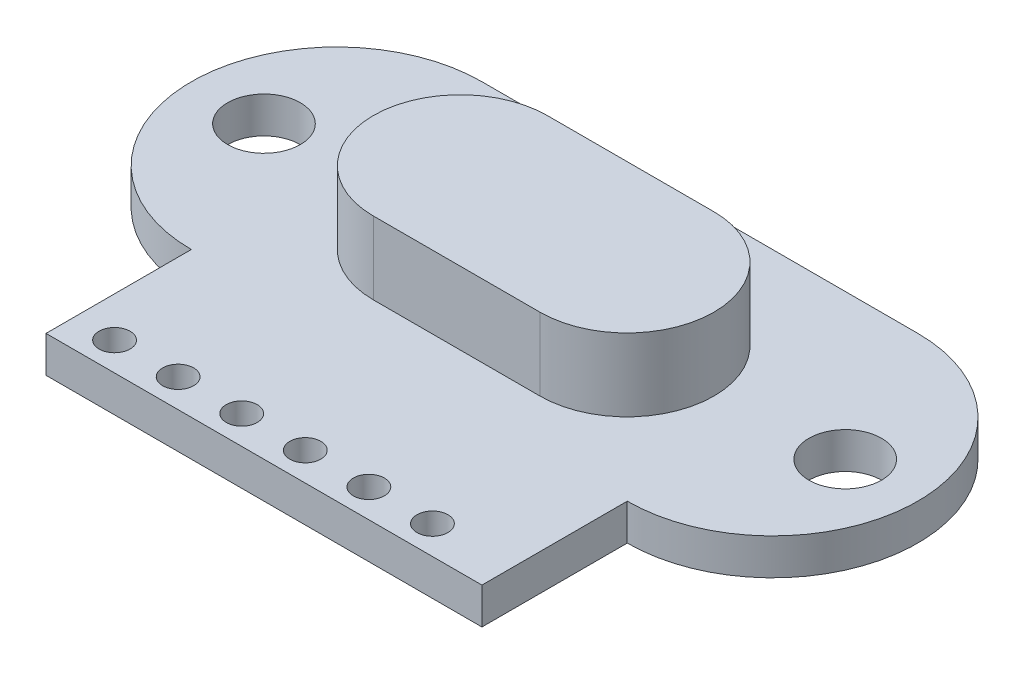
from build123d import *

# Parameters (mm, degrees)
BOSS_EXTRUDE1_DEPTH = 1
SKETCH2_W           = 12
SKETCH2_H           = 4
BOSS_EXTRUDE2_DEPTH = 1
SKETCH3_R           = 1
SKETCH3_R_2         = 0.426779722
CUT_EXTRUDE1_DEPTH  = 16.652475842
BOSS_EXTRUDE3_DEPTH = 2
SKETCH5_W           = 8.547335384
SKETCH5_H           = 5.323692461
BOSS_EXTRUDE4_DEPTH = 1


with BuildPart() as part:
    # Sketch1 → Boss-Extrude1 (new body)
    with BuildSketch(Plane(origin=(0, 0, 0), x_dir=(1, 0, 0), z_dir=(0, 1, 0))):
        with BuildLine():
            Line((-6, 12), (6, 12))
            ThreePointArc((6, 12), (10, 8), (6, 4))
            Line((6, 4), (-6, 4))
            ThreePointArc((-6, 4), (-10, 8), (-6, 12))
        make_face()
    extrude(amount=BOSS_EXTRUDE1_DEPTH)

    # Sketch2 → Boss-Extrude2 (add)
    with BuildSketch(Plane.XZ):
        with Locations((0, -2)):
            Rectangle(SKETCH2_W, SKETCH2_H)
    extrude(amount=-BOSS_EXTRUDE2_DEPTH)

    # Sketch3 → Cut-Extrude1 (cut, through all)
    with BuildSketch(Plane(origin=(0, 1, 0), x_dir=(1, 0, 0), z_dir=(0, 1, 0))):
        with Locations((8, 8)):
            Circle(SKETCH3_R)
        with Locations((-8, 8)):
            Circle(SKETCH3_R)
        with Locations((-4.895656887, 0.783316432)):
            Circle(SKETCH3_R_2)
        with Locations((-3.145656887, 0.783316432)):
            Circle(SKETCH3_R_2)
        with Locations((-1.395656887, 0.783316432)):
            Circle(SKETCH3_R_2)
        with Locations((0.354343113, 0.783316432)):
            Circle(SKETCH3_R_2)
        with Locations((2.104343113, 0.783316432)):
            Circle(SKETCH3_R_2)
        with Locations((3.854343113, 0.783316432)):
            Circle(SKETCH3_R_2)
    extrude(amount=-CUT_EXTRUDE1_DEPTH, mode=Mode.SUBTRACT)

    # Sketch4 → Boss-Extrude3 (add)
    with BuildSketch(Plane(origin=(0, 1, 0), x_dir=(1, 0, 0), z_dir=(0, 1, 0))):
        with BuildLine():
            Line((-2.294003159, 10.093090184), (2.294003159, 10.093090184))
            ThreePointArc((2.294003159, 10.093090184), (4.688327155, 7.698766187), (2.294003159, 5.304442191))
            Line((2.294003159, 5.304442191), (-2.294003159, 5.304442191))
            ThreePointArc((-2.294003159, 5.304442191), (-4.688327155, 7.698766187), (-2.294003159, 10.093090184))
        make_face()
    extrude(amount=BOSS_EXTRUDE3_DEPTH)

    # Sketch5 → Boss-Extrude4 (add)
    with BuildSketch(Plane.XZ):
        with Locations((-0.127073061, -6.949703932)):
            Rectangle(SKETCH5_W, SKETCH5_H)
    extrude(amount=BOSS_EXTRUDE4_DEPTH)


solid = part.part
